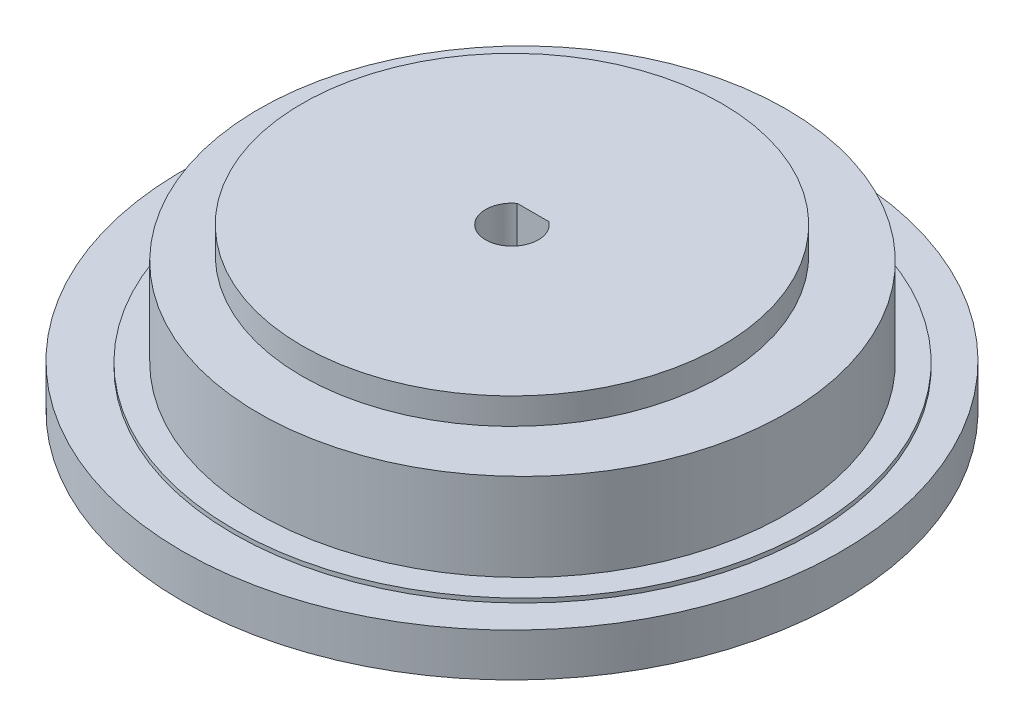
from build123d import *

# Parameters (mm, degrees)
SKETCH1_R           = 25
BOSS_EXTRUDE1_DEPTH = 10.8
BOSS_EXTRUDE2_START = 2
SKETCH2_R           = 31.25
SKETCH2_R_2         = 2.5
BOSS_EXTRUDE2_DEPTH = 2
BOSS_EXTRUDE3_START = 2.5
SKETCH3_R           = 31.25
SKETCH3_R_2         = 30.1
SKETCH3_R_3         = 19.9
SKETCH3_R_4         = 2.5
BOSS_EXTRUDE3_DEPTH = 2.5
CUT_EXTRUDE1_START  = -0.4
SKETCH4_R           = 31.25
SKETCH4_R_2         = 27.4
CUT_EXTRUDE1_DEPTH  = 0.4
CUT_EXTRUDE2_START  = -2.5
SKETCH5_R           = 25
SKETCH5_R_2         = 19.9
CUT_EXTRUDE2_DEPTH  = 2.5


with BuildPart() as part:
    # Sketch1 → Boss-Extrude1 (new body)
    with BuildSketch(Plane(origin=(0, 0, 0), x_dir=(1, 0, 0), z_dir=(0, 1, 0))):
        Circle(SKETCH1_R)
        with BuildLine():
            Line((-2.5, 2), (0.5, 2))
            ThreePointArc((0.5, 2), (-1, -2.5), (-2.5, 2))
        make_face(mode=Mode.SUBTRACT)
    extrude(amount=BOSS_EXTRUDE1_DEPTH)

    # Sketch2 → Boss-Extrude2 (add)
    with BuildSketch(Plane.XZ.offset(BOSS_EXTRUDE2_START)):
        with Locations((-1, 0)):
            Circle(SKETCH2_R)
        with Locations((-1, 0)):
            Circle(SKETCH2_R_2, mode=Mode.SUBTRACT)
    extrude(amount=-BOSS_EXTRUDE2_DEPTH)

    # Sketch3 → Boss-Extrude3 (add)
    # profile 1 of 2: a face of its own
    with BuildSketch(Plane.XZ.offset(2).offset(BOSS_EXTRUDE3_START)):
        with Locations((-1, 0)):
            Circle(SKETCH3_R)
        with Locations((-1, 0)):
            Circle(SKETCH3_R_2, mode=Mode.SUBTRACT)
    # profile 2 of 2: a face of its own
    with BuildSketch(Plane.XZ.offset(2).offset(BOSS_EXTRUDE3_START)):
        with Locations((-1, 0)):
            Circle(SKETCH3_R_3)
        with Locations((-1, 0)):
            Circle(SKETCH3_R_4, mode=Mode.SUBTRACT)
    extrude(amount=-BOSS_EXTRUDE3_DEPTH)

    # Sketch4 → Cut-Extrude1 (cut)
    with BuildSketch(Plane(origin=(0, 0, 0), x_dir=(1, 0, 0), z_dir=(0, 1, 0)).offset(CUT_EXTRUDE1_START)):
        with Locations((-1, 0)):
            Circle(SKETCH4_R)
        Circle(SKETCH4_R_2, mode=Mode.SUBTRACT)
    extrude(amount=CUT_EXTRUDE1_DEPTH, mode=Mode.SUBTRACT)

    # Sketch5 → Cut-Extrude2 (cut)
    with BuildSketch(Plane(origin=(0, 10.8, 0), x_dir=(1, 0, 0), z_dir=(0, 1, 0)).offset(CUT_EXTRUDE2_START)):
        Circle(SKETCH5_R)
        with Locations((-1, 0)):
            Circle(SKETCH5_R_2, mode=Mode.SUBTRACT)
    extrude(amount=CUT_EXTRUDE2_DEPTH, mode=Mode.SUBTRACT)


solid = part.part
